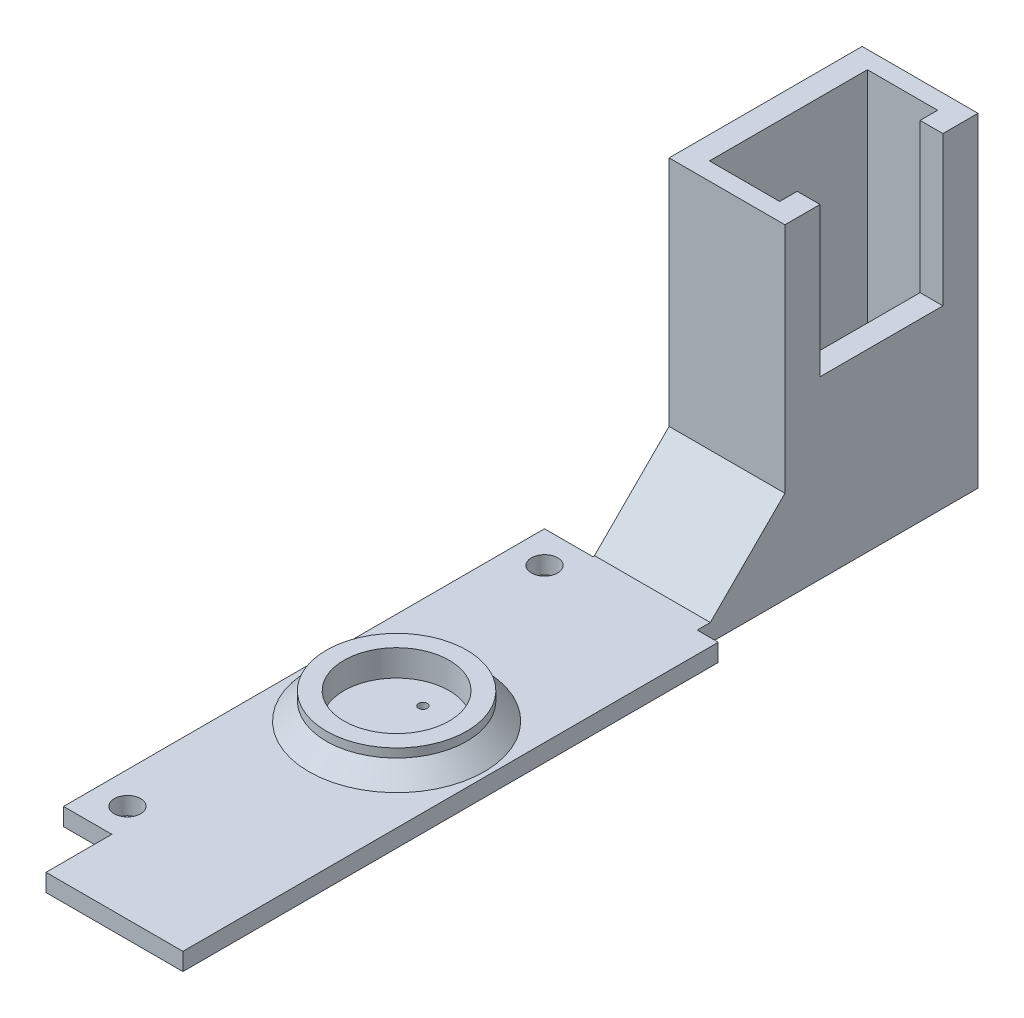
from build123d import *

# Parameters (mm, degrees)
BOSS_EXTRUDE1_DEPTH  = 1.5
SKETCH2_W            = 4.8
SKETCH2_H            = 18
BOSS_EXTRUDE2_DEPTH  = 20
SKETCH3_R            = 1.5
CUT_EXTRUDE1_DEPTH   = 20
SKETCH4_R            = 3
SKETCH4_R_2          = 1.5
SKETCH4_W            = 4.828517764
SKETCH4_H            = 3.2
SKETCH4_W_2          = 5.829541735
SKETCH4_H_2          = 5.702554953
SKETCH4_W_3          = 4.58984945
BOSS_EXTRUDE3_DEPTH  = 3.8
SKETCH5_W            = 7.960049614
SKETCH5_H            = 4.589179968
SKETCH5_R            = 1.5
SKETCH5_W_2          = 8.506770289
SKETCH5_H_2          = 5.091999219
SKETCH5_W_3          = 7.172313144
SKETCH5_H_3          = 12.5
SKETCH5_H_4          = 13
BOSS_EXTRUDE4_DEPTH  = 4.25
SKETCH6_W            = 6.917388718
SKETCH6_H            = 7.693263261
SKETCH6_R            = 1.5
SKETCH6_W_2          = 6.017640473
SKETCH6_H_2          = 7.169329529
BOSS_EXTRUDE5_DEPTH  = 12.5
SKETCH7_R            = 1.5
BOSS_EXTRUDE7_DEPTH  = 2
INTERSECT1_DEPTH     = 21.5
SKETCH8_W            = 13.2
SKETCH8_H            = 22
BOSS_EXTRUDE8_DEPTH  = 18
SKETCH9_W            = 8
SKETCH9_H            = 12
CUT_EXTRUDE2_DEPTH   = 26
BOSS_EXTRUDE9_DEPTH  = 17
CHAMFER1_SIZE        = 8.5
SKETCH11_R           = 0.5
CUT_EXTRUDE3_DEPTH   = 17
SKETCH12_R           = 8
SKETCH12_R_2         = 6
BOSS_EXTRUDE10_DEPTH = 3
CHAMFER2_SIZE        = 2


# Read off the part's stored shape, not the designer's step: Intersect1
with BuildPart() as part:
    # Sketch1 → Boss-Extrude1 (new body)
    with BuildSketch(Plane(origin=(0, 0, 0), x_dir=(1, 0, 0), z_dir=(0, 1, 0))):
        Polygon((-60, -67.5), (-60, -72.5), (-52, -72.5), (-52, -67.5), (52, -67.5), (52, -72.5), (60, -72.5), (60, -67.5), (60, 67.5), (-60, 67.5), (-60, 36.8), (-65.5, 36.8), (-65.5, 29.3), (-60, 29.3), (-60, 16.8), (-65.5, 16.8), (-65.5, 7.8), (-65.5, -1.2), (-60, -1.2), (-60, -10.5), (-65.5, -10.5), (-65.5, -18), (-60, -18), align=None)
    extrude(amount=BOSS_EXTRUDE1_DEPTH)

    # Sketch2 → Boss-Extrude2 (add)
    with BuildSketch(Plane(origin=(0, 1.5, 0), x_dir=(1, 0, 0), z_dir=(0, 1, 0))):
        Polygon((-58, 62.8), (-58, 29.3), (-60, 29.3), (-65.5, 29.3), (-65.5, 36.8), (-60, 36.8), (-60, 67.5), (-55.3, 67.5), (-55.3, 65.5), align=None)
        with BuildLine():
            Line((-58, -65.5), (58, -65.5))
            Line((58, -65.5), (58, -25.5))
            Line((58, -25.5), (29.8, -25.5))
            Line((29.8, -25.5), (29.8, -18))
            Line((29.8, -18), (58, -18))
            Line((58, -18), (58, 38.5))
            ThreePointArc((58, 38.5), (57.414213562, 39.914213562), (56, 40.5))
            Line((56, 40.5), (51.8, 40.5))
            ThreePointArc((51.8, 40.5), (50.385786438, 41.085786438), (49.8, 42.5))
            Line((49.8, 42.5), (49.8, 48.75))
            Line((49.8, 48.75), (51.3, 48.75))
            Line((51.3, 48.75), (51.3, 47.25))
            Line((51.3, 47.25), (58, 47.25))
            Line((58, 47.25), (58, 51.25))
            Line((58, 51.25), (60, 51.25))
            Line((60, 51.25), (60, -72.5))
            Line((60, -72.5), (52, -72.5))
            Line((52, -72.5), (52, -67.5))
            Line((52, -67.5), (-52, -67.5))
            Line((-52, -67.5), (-52, -72.5))
            Line((-52, -72.5), (-60, -72.5))
            Line((-60, -72.5), (-60, -52.5))
            Line((-60, -52.5), (-58, -52.5))
            Line((-58, -52.5), (-58, -65.5))
        make_face()
        Polygon((-60, 16.8), (-58, 16.8), (-58, -1.2), (-60, -1.2), (-65.5, -1.2), (-65.5, 16.8), align=None)
        Polygon((-60, -10.5), (-58, -10.5), (-58, -38), (-60, -38), (-60, -18), (-65.5, -18), (-65.5, -10.5), align=None)
        with BuildLine():
            Line((-48.8, 67.5), (-48.8, 65.5))
            Line((-48.8, 65.5), (-46.8, 62.8))
            Line((-46.8, 62.8), (-46.8, 58.5))
            Line((-46.8, 58.5), (-44.8, 58.5))
            Line((-44.8, 58.5), (-37.8, 64.5))
            Line((-37.8, 64.5), (38.8, 64.5))
            Line((38.8, 64.5), (44.8, 58.5))
            Line((44.8, 58.5), (44.8, 46.5))
            Line((44.8, 46.5), (41.3, 46.5))
            Line((41.3, 46.5), (41.3, 42.5))
            Line((41.3, 42.5), (38.85, 42.5))
            Line((38.85, 42.5), (38.85, 40.5))
            Line((38.85, 40.5), (44.8, 40.5))
            ThreePointArc((44.8, 40.5), (46.214213562, 41.085786438), (46.8, 42.5))
            Line((46.8, 42.5), (46.8, 46.5))
            Line((46.8, 46.5), (46.8, 57.25))
            Line((46.8, 57.25), (51.3, 57.25))
            Line((51.3, 57.25), (51.3, 58.75))
            Line((51.3, 58.75), (58, 58.75))
            Line((58, 58.75), (58, 54.75))
            Line((58, 54.75), (60, 54.75))
            Line((60, 54.75), (60, 67.5))
            Line((60, 67.5), (-48.8, 67.5))
        make_face()
        Polygon((-46.8, 46.5), (-39.5, 46.5), (-39.5, 42.5), (-37.05, 42.5), (-37.05, 40.5), (-46.8, 40.5), align=None)
        Polygon((-33.55, 42.5), (-33.55, 40.5), (-18.65, 40.5), (-18.65, 42.5), (-21.1, 42.5), (-21.1, 46.5), (-31.1, 46.5), (-31.1, 42.5), align=None)
        Polygon((-15.55, 40.5), (-0.65, 40.5), (-0.65, 42.5), (-3.1, 42.5), (-3.1, 46.5), (-13.1, 46.5), (-13.1, 42.5), (-15.55, 42.5), align=None)
        Polygon((2.45, 40.5), (17.35, 40.5), (17.35, 42.5), (14.9, 42.5), (14.9, 46.5), (4.9, 46.5), (4.9, 42.5), (2.45, 42.5), align=None)
        Polygon((20.45, 40.5), (35.35, 40.5), (35.35, 42.5), (32.9, 42.5), (32.9, 46.5), (22.9, 46.5), (22.9, 42.5), (20.45, 42.5), align=None)
        Polygon((-46.8, 35.5), (-49.2, 35.5), (-49.2, 29.3), (-44.4, 29.3), (-44.4, 35.5), align=None)
        with Locations((-46.8, 7.8)):
            Rectangle(SKETCH2_W, SKETCH2_H)
        Polygon((-49.2, -10.5), (-44.4, -10.5), (-44.4, -18), (-16.9, -18), (-16.9, -25.5), (-46.4, -25.5), (-46.4, -19.9), (-49.2, -14), align=None)
    extrude(amount=BOSS_EXTRUDE2_DEPTH)

    # Sketch3 → Cut-Extrude1 (cut)
    with BuildSketch(Plane(origin=(0, 21.5, 0), x_dir=(1, 0, 0), z_dir=(0, 1, 0))):
        with Locations(Location((52.774715074, 63.354517547, 0), (0, 0, 270))):
            Circle(SKETCH3_R)
        with Locations(Location((-43.84271688, 64.854517547, 0), (0, 0, 270))):
            Circle(SKETCH3_R)
        with Locations(Location((-61.879270776, 33.191143968, 0), (0, 0, 270))):
            Circle(SKETCH3_R)
        with Locations(Location((-61.879270776, -14.337618299, 0), (0, 0, 270))):
            Circle(SKETCH3_R)
        with Locations(Location((54.274715074, 43.945098524, 0), (0, 0, 270))):
            Circle(SKETCH3_R)
        with Locations(Location((-21.029637868, -21.862387391, 0), (0, 0, 270))):
            Circle(SKETCH3_R)
        with Locations(Location((34.3, -21.75, 0), (0, 0, 270))):
            Circle(SKETCH3_R)
        with Locations(Location((-56, -69, 0), (0, 0, 270))):
            Circle(SKETCH3_R)
        with Locations(Location((56, -69, 0), (0, 0, 270))):
            Circle(SKETCH3_R)
    extrude(amount=-CUT_EXTRUDE1_DEPTH, mode=Mode.SUBTRACT)

    # Sketch4 → Boss-Extrude3 (add)
    # profile 1 of 5: a face of its own
    with BuildSketch(Plane(origin=(0, 1.5, 0), x_dir=(1, 0, 0), z_dir=(0, 1, 0))):
        with Locations(Location((21.544764921, -8.320497528, 0), (0, 0, 90))):
            Circle(SKETCH4_R)
        with Locations(Location((21.544764921, -8.320497528, 0), (0, 0, 90))):
            Circle(SKETCH4_R_2, mode=Mode.SUBTRACT)
    # profile 2 of 5: a face of its own
    with BuildSketch(Plane(origin=(0, 1.5, 0), x_dir=(1, 0, 0), z_dir=(0, 1, 0))):
        with Locations(Location((21.544764921, 19.479502472, 0), (0, 0, 90))):
            Circle(SKETCH4_R)
        with Locations(Location((21.544764921, 19.479502472, 0), (0, 0, 90))):
            Circle(SKETCH4_R_2, mode=Mode.SUBTRACT)
    # profile 3 of 5: a face of its own
    with BuildSketch(Plane(origin=(0, 1.5, 0), x_dir=(1, 0, 0), z_dir=(0, 1, 0))):
        with Locations((-29.2, 33.9)):
            Rectangle(SKETCH4_W, SKETCH4_H)
        with Locations(Location((-29.2, 33.9, 0), (0, 0, 90))):
            Circle(SKETCH4_R_2, mode=Mode.SUBTRACT)
    # profile 4 of 5: a face of its own
    with BuildSketch(Plane(origin=(0, 1.5, 0), x_dir=(1, 0, 0), z_dir=(0, 1, 0))):
        with Locations((-30.25253813, -15.148722524)):
            Rectangle(SKETCH4_W_2, SKETCH4_H_2)
        with Locations(Location((-30.3, -14.4, 0), (0, 0, 90))):
            Circle(SKETCH4_R_2, mode=Mode.SUBTRACT)
    # profile 5 of 5: a face of its own
    with BuildSketch(Plane(origin=(0, 1.5, 0), x_dir=(1, 0, 0), z_dir=(0, 1, 0))):
        with Locations((51.718864017, -15.148722524)):
            Rectangle(SKETCH4_W_3, SKETCH4_H_2)
        with Locations(Location((51.8, -14.4, 0), (0, 0, 90))):
            Circle(SKETCH4_R_2, mode=Mode.SUBTRACT)
    extrude(amount=BOSS_EXTRUDE3_DEPTH)

    # Sketch5 → Boss-Extrude4 (add)
    # profile 1 of 4: a face of its own
    with BuildSketch(Plane(origin=(0, 1.5, 0), x_dir=(1, 0, 0), z_dir=(0, 1, 0))):
        with Locations((-54.019975193, -35.705410016)):
            Rectangle(SKETCH5_W, SKETCH5_H)
        with Locations(Location((-52.773553759, -35.8, 0), (0, 0, 270))):
            Circle(SKETCH5_R, mode=Mode.SUBTRACT)
    # profile 2 of 4: a face of its own
    with BuildSketch(Plane(origin=(0, 1.5, 0), x_dir=(1, 0, 0), z_dir=(0, 1, 0))):
        with Locations((-53.746614856, -55.04599961)):
            Rectangle(SKETCH5_W_2, SKETCH5_H_2)
        with Locations(Location((-52.773553759, -54.7, 0), (0, 0, 270))):
            Circle(SKETCH5_R, mode=Mode.SUBTRACT)
    # profile 3 of 4: a face of its own
    with BuildSketch(Plane(origin=(0, 1.5, 0), x_dir=(1, 0, 0), z_dir=(0, 1, 0))):
        with Locations((-27.40354529, -31.75)):
            Rectangle(SKETCH5_W_3, SKETCH5_H_3)
        with Locations(Location((-27.173553759, -35.8, 0), (0, 0, 270))):
            Circle(SKETCH5_R, mode=Mode.SUBTRACT)
    # profile 4 of 4: a face of its own
    with BuildSketch(Plane(origin=(0, 1.5, 0), x_dir=(1, 0, 0), z_dir=(0, 1, 0))):
        with Locations((-27.40354529, -59)):
            Rectangle(SKETCH5_W_3, SKETCH5_H_4)
        with Locations(Location((-27.173553759, -54.7, 0), (0, 0, 270))):
            Circle(SKETCH5_R, mode=Mode.SUBTRACT)
    extrude(amount=BOSS_EXTRUDE4_DEPTH)

    # Sketch6 → Boss-Extrude5 (add)
    # profile 1 of 4: a face of its own
    with BuildSketch(Plane(origin=(0, 1.5, 0), x_dir=(1, 0, 0), z_dir=(0, 1, 0))):
        with Locations((-20.358694359, -29.346631631)):
            Rectangle(SKETCH6_W, SKETCH6_H)
        with Locations(Location((-19.26, -30.5, 0), (0, 0, 270))):
            Circle(SKETCH6_R, mode=Mode.SUBTRACT)
    # profile 2 of 4: a face of its own
    with BuildSketch(Plane(origin=(0, 1.5, 0), x_dir=(1, 0, 0), z_dir=(0, 1, 0))):
        with Locations((54.991179763, -29.346631631)):
            Rectangle(SKETCH6_W_2, SKETCH6_H)
        with Locations(Location((55.14, -30.5, 0), (0, 0, 270))):
            Circle(SKETCH6_R, mode=Mode.SUBTRACT)
    # profile 3 of 4: a face of its own
    with BuildSketch(Plane(origin=(0, 1.5, 0), x_dir=(1, 0, 0), z_dir=(0, 1, 0))):
        with Locations((54.991179763, -61.915335236)):
            Rectangle(SKETCH6_W_2, SKETCH6_H_2)
        with Locations(Location((55.14, -61.1, 0), (0, 0, 270))):
            Circle(SKETCH6_R, mode=Mode.SUBTRACT)
    # profile 4 of 4: a face of its own
    with BuildSketch(Plane(origin=(0, 1.5, 0), x_dir=(1, 0, 0), z_dir=(0, 1, 0))):
        with Locations((-20.358694359, -61.915335236)):
            Rectangle(SKETCH6_W, SKETCH6_H_2)
        with Locations(Location((-19.26, -61.1, 0), (0, 0, 270))):
            Circle(SKETCH6_R, mode=Mode.SUBTRACT)
    extrude(amount=BOSS_EXTRUDE5_DEPTH)

    # Intersect1 outline → Intersect1 (cut)
    with BuildSketch(Plane(origin=(0, 0, 0), x_dir=(1, 0, 0), z_dir=(0, 1, 0))):
        Polygon((-60, -72.5), (-52, -72.5), (-52, -67.5), (52, -67.5), (52, -72.5), (60, -72.5), (60, 67.5), (-60, 67.5), (-60, 36.8), (-65.5, 36.8), (-65.5, 29.3), (-60, 29.3), (-60, 16.8), (-65.5, 16.8), (-65.5, -1.2), (-60, -1.2), (-60, -10.5), (-65.5, -10.5), (-65.5, -18), (-60, -18), align=None)
    extrude(amount=INTERSECT1_DEPTH, mode=Mode.SUBTRACT)


with BuildPart() as body_2:
    # Sketch7 → Boss-Extrude7 (new body)
    with BuildSketch(Plane(origin=(0, 21.5, 0), x_dir=(1, 0, 0), z_dir=(0, 1, 0))):
        Polygon((-60, 67.5), (-60, 36.8), (-65.5, 36.8), (-65.5, -18), (-60, -18), (-60, -25.5), (-46.4, -25.5), (-44.4, -25.5), (-44.4, -10.5), (-44.4, 35.5), (-46.8, 35.5), (-46.8, 62.8), (-46.8, 67.5), align=None)
        with Locations(Location((-61.879270776, -14.337618299, 0), (0, 0, 270))):
            Circle(SKETCH7_R, mode=Mode.SUBTRACT)
        with Locations(Location((-61.879270776, 33.191143968, 0), (0, 0, 270))):
            Circle(SKETCH7_R, mode=Mode.SUBTRACT)
    extrude(amount=BOSS_EXTRUDE7_DEPTH)

    # Sketch8 → Boss-Extrude8 (add)
    with BuildSketch(Plane(origin=(0, 23.5, 0), x_dir=(1, 0, 0), z_dir=(0, 1, 0))):
        with Locations((-53.4, 56.5)):
            Rectangle(SKETCH8_W, SKETCH8_H)
        Polygon((-53.4, 65.5), (-57.4, 65.5), (-57.4, 47.5), (-53.4, 47.5), (-49.4, 47.5), (-49.4, 65.5), align=None, mode=Mode.SUBTRACT)
    extrude(amount=BOSS_EXTRUDE8_DEPTH)

    # Sketch9 → Cut-Extrude2 (cut)
    with BuildSketch(Plane(origin=(0, 23.5, 0), x_dir=(1, 0, 0), z_dir=(0, 1, 0))):
        with Locations((-53.4, 56.5)):
            Rectangle(SKETCH9_W, SKETCH9_H)
    extrude(amount=-CUT_EXTRUDE2_DEPTH, mode=Mode.SUBTRACT)

    # Sketch10 → Boss-Extrude9 (add)
    with BuildSketch(Plane(origin=(0, 41.5, 0), x_dir=(1, 0, 0), z_dir=(0, 1, 0))):
        Polygon((-49.4, 63.5), (-46.8, 63.5), (-46.8, 67.5), (-60, 67.5), (-60, 45.5), (-46.8, 45.5), (-46.8, 49.5), (-49.4, 49.5), (-49.4, 47.5), (-57.4, 47.5), (-57.4, 65.5), (-49.4, 65.5), align=None)
    extrude(amount=BOSS_EXTRUDE9_DEPTH)

    # Chamfer1
    chamfer1_edges = [body_2.edges().sort_by_distance(p)[0] for p in [
        (-53.4, 23.5, -45.5),
    ]]
    chamfer(chamfer1_edges, length=CHAMFER1_SIZE)

    # Sketch11 → Cut-Extrude3 (cut)
    with BuildSketch(Plane(origin=(0, 23.5, 0), x_dir=(1, 0, 0), z_dir=(0, 1, 0))):
        with Locations(Location((-54.95, 12.4, 0), (0, 0, 270))):
            Circle(SKETCH11_R)
        with Locations(Location((-54.95, 6.4, 0), (0, 0, 90))):
            Circle(SKETCH11_R)
    extrude(amount=-CUT_EXTRUDE3_DEPTH, mode=Mode.SUBTRACT)

    # Sketch12 → Boss-Extrude10 (add)
    with BuildSketch(Plane(origin=(0, 23.5, 0), x_dir=(1, 0, 0), z_dir=(0, 1, 0))):
        with Locations(Location((-54.95, 9.4, 0), (0, 0, 270))):
            Circle(SKETCH12_R)
        with Locations(Location((-54.95, 9.4, 0), (0, 0, 270))):
            Circle(SKETCH12_R_2, mode=Mode.SUBTRACT)
    extrude(amount=BOSS_EXTRUDE10_DEPTH)

    # Chamfer2
    chamfer2_edges = [body_2.edges().sort_by_distance(p)[0] for p in [
        (-54.95, 23.5, -17.4),
    ]]
    chamfer(chamfer2_edges, length=CHAMFER2_SIZE)


solid = body_2.part
